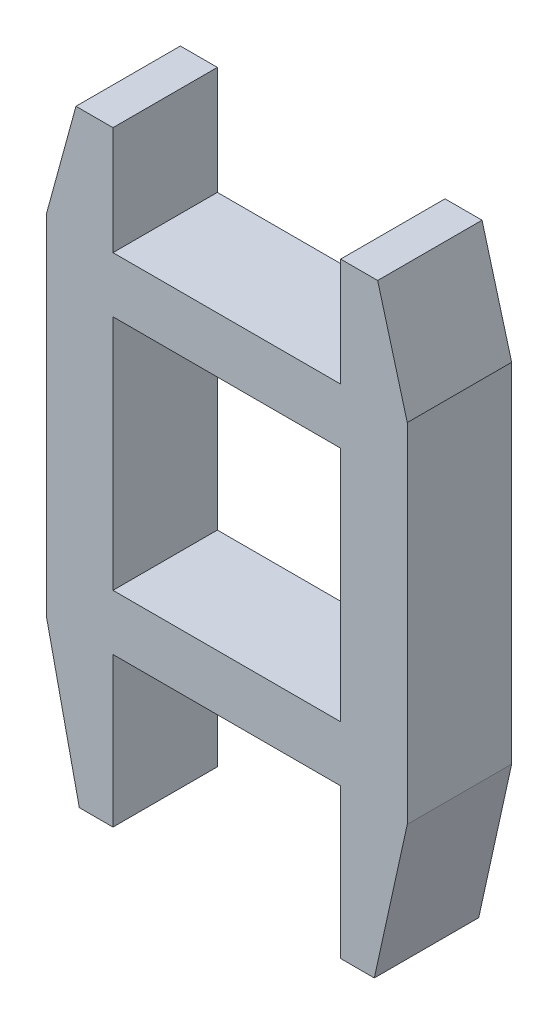
from build123d import *

# Parameters (mm, degrees)
SKETCH1_W           = 12.3
SKETCH1_H           = 12.8
BOSS_EXTRUDE1_DEPTH = 5.64


with BuildPart() as part:
    # Sketch1 → Boss-Extrude1 (new body)
    with BuildSketch(Plane.XY):
        Polygon((1245.259623553, 971.126361431), (1247.259623553, 971.126361431), (1247.259623553, 965.277195661), (1259.559623553, 965.277195661), (1259.559623553, 971.126361431), (1261.559623553, 971.126361431), (1263.159623553, 965.277195661), (1263.159623553, 946.477195661), (1261.378886532, 938.398029891), (1259.559623553, 938.398029891), (1259.559623553, 946.477195661), (1247.259623553, 946.477195661), (1247.259623553, 938.398029891), (1245.440360574, 938.398029891), (1243.659623553, 946.477195661), (1243.659623553, 965.277195661), align=None)
        with Locations((1253.409623553, 955.877195661)):
            Rectangle(SKETCH1_W, SKETCH1_H, mode=Mode.SUBTRACT)
    extrude(amount=BOSS_EXTRUDE1_DEPTH)


solid = part.part
